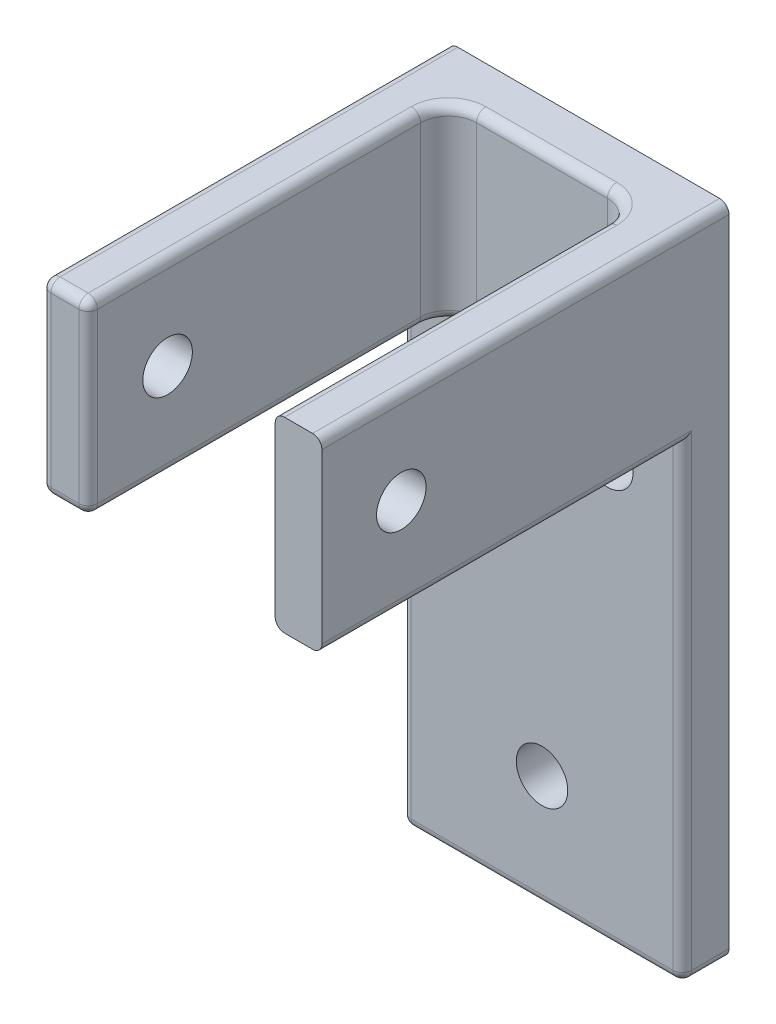
from build123d import *

# Parameters (mm, degrees)
SKETCH1_W            = 30
SKETCH1_H            = 70
BOSS_EXTRUDE1_DEPTH  = 5
M5_CLEARANCE_HOLE1_D = 5.5
SKETCH4_W            = 5
SKETCH4_H            = 20
BOSS_EXTRUDE2_DEPTH  = 38.541999878
M5_CLEARANCE_HOLE2_D = 5.3
FILLET1_R            = 3
FILLET2_R            = 1
FILLET3_R            = 1
FILLET4_R            = 1
FILLET5_R            = 1
FILLET6_R            = 1


with BuildPart() as part:
    # Sketch1 → Boss-Extrude1 (new body)
    with BuildSketch(Plane.XY):
        Rectangle(SKETCH1_W, SKETCH1_H)
    extrude(amount=BOSS_EXTRUDE1_DEPTH)

    # M5 Clearance Hole1 (through all)
    with Locations(Plane.XY.offset(5)):
        with Locations((0, -23), (-7, 10), (7, 10)):
            Hole(M5_CLEARANCE_HOLE1_D / 2)

    # Sketch4 → Boss-Extrude2 (add)
    with BuildSketch(Plane.XY.offset(5)):
        with Locations((-12.5, 25)):
            Rectangle(SKETCH4_W, SKETCH4_H)
        with Locations((12.5, 25)):
            Rectangle(SKETCH4_W, SKETCH4_H)
    extrude(amount=BOSS_EXTRUDE2_DEPTH)

    # M5 Clearance Hole2 (through all)
    with Locations(Plane.ZY.offset(15)):
        with Locations((35.052, 25)):
            Hole(M5_CLEARANCE_HOLE2_D / 2)

    # Fillet1
    fillet1_edges = [part.edges().sort_by_distance(p)[0] for p in [
        (-10, 25, 5),
        (10, 25, 5),
    ]]
    fillet(fillet1_edges, radius=FILLET1_R)

    # Fillet2
    fillet2_edges = [part.edges().sort_by_distance(p)[0] for p in [
        (-15, 25, 43.541999878),
        (-10, 25, 43.541999878),
    ]]
    fillet(fillet2_edges, radius=FILLET2_R)

    # Fillet3
    # the kernel refuses this fillet: 1 mm, written as the material it takes off along each edge
    with BuildSketch(Plane(origin=(7, 15, 8), x_dir=(-0.7404019062872322, 0, -0.6721644271800112), z_dir=(-0.6721644271800112, 0, 0.7404019062872322))) as fillet3_piece_1_section:
        with BuildLine():
            CenterArc((3 + FILLET3_R, -FILLET3_R), FILLET3_R, 90, 90)
            Line((3 + FILLET3_R, 0), (3, 0))
            Line((3, 0), (3, -FILLET3_R))
        make_face()
    fillet3_piece_1 = revolve(axis=Axis((7, 15, 8), (0, -1, 0)), revolution_arc=137.765663079, mode=Mode.PRIVATE)
    fillet3_piece_1 = split(fillet3_piece_1, bisect_by=Plane(origin=(9.145909212, 15.257974559, 5), z_dir=(0, 0, 1)), keep=Keep.TOP, mode=Mode.PRIVATE)
    add(fillet3_piece_1, mode=Mode.SUBTRACT)
    with BuildSketch(Plane(origin=(-7, 15, 8), x_dir=(0.7404019062872333, 0, -0.6721644271800099), z_dir=(0.6721644271800099, 0, 0.7404019062872333))) as fillet3_piece_2_section:
        with BuildLine():
            CenterArc((3 + FILLET3_R, FILLET3_R), FILLET3_R, 180, 90)
            Line((3 + FILLET3_R, 0), (3, 0))
            Line((3, 0), (3, FILLET3_R))
        make_face()
    fillet3_piece_2 = revolve(axis=Axis((-7, 15, 8), (0, 1, 0)), revolution_arc=137.765663079, mode=Mode.PRIVATE)
    fillet3_piece_2 = split(fillet3_piece_2, bisect_by=Plane(origin=(-9.145909903, 15.257974038, 5), z_dir=(0, 0, 1)), keep=Keep.TOP, mode=Mode.PRIVATE)
    add(fillet3_piece_2, mode=Mode.SUBTRACT)
    with BuildSketch(Plane(origin=(-10, 15, 8), x_dir=(0, 1, 0), z_dir=(0, 0, 1))) as fillet3_piece_3:
        with BuildLine():
            CenterArc((FILLET3_R, FILLET3_R), FILLET3_R, 180, 90)
            Line((0, FILLET3_R), (0, 0))
            Line((0, 0), (FILLET3_R, 0))
        make_face()
    extrude(amount=34.541999878, mode=Mode.SUBTRACT)
    with BuildSketch(Plane(origin=(-11, 15, 42.541999878), x_dir=(1, 0, 0), z_dir=(0, 0, -1))) as fillet3_piece_4:
        with BuildLine():
            CenterArc((1 - FILLET3_R, -FILLET3_R), FILLET3_R, 0, 90)
            Line((1 - FILLET3_R, 0), (1, 0))
            Line((1, 0), (1, -FILLET3_R))
        make_face()
    revolve(axis=Axis((-11, 15, 42.541999878), (0, -1, 0)), revolution_arc=90, mode=Mode.SUBTRACT)
    with BuildSketch(Plane(origin=(-11, 15, 43.541999878), x_dir=(0, 0, -1), z_dir=(-1, 0, 0)), Plane(origin=(-14, 35, 43.541999878), x_dir=(0, 0, -1), z_dir=(1, 0, 0))) as fillet3_piece_5:
        with BuildLine():
            CenterArc((FILLET3_R, -FILLET3_R), FILLET3_R, 90, 90)
            Line((0, -FILLET3_R), (0, 0))
            Line((0, 0), (FILLET3_R, 0))
        make_face()
    extrude(amount=3, mode=Mode.SUBTRACT)
    with BuildSketch(Plane(origin=(-14, 15, 42.541999878), x_dir=(0, 0, 1), z_dir=(1, 0, 0))) as fillet3_piece_6:
        with BuildLine():
            CenterArc((1 - FILLET3_R, -FILLET3_R), FILLET3_R, 0, 90)
            Line((1, -FILLET3_R), (1, 0))
            Line((1, 0), (1 - FILLET3_R, 0))
        make_face()
    revolve(axis=Axis((-14, 15, 42.541999878), (0, -1, 0)), revolution_arc=90, mode=Mode.SUBTRACT)
    with BuildSketch(Plane(origin=(7, 35, 8), x_dir=(0, 0, -1), z_dir=(-1, 0, 0))) as fillet3_piece_7:
        with BuildLine():
            CenterArc((3 + FILLET3_R, FILLET3_R), FILLET3_R, 180, 90)
            Line((3, FILLET3_R), (3, 0))
            Line((3, 0), (3 + FILLET3_R, 0))
        make_face()
    revolve(axis=Axis((7, 35, 8), (0, -1, 0)), revolution_arc=90, mode=Mode.SUBTRACT)
    with BuildSketch(Plane(origin=(-7, 35, 5), x_dir=(0, 0, -1), z_dir=(1, 0, 0))) as fillet3_piece_8:
        with BuildLine():
            CenterArc((FILLET3_R, -FILLET3_R), FILLET3_R, 90, 90)
            Line((0, -FILLET3_R), (0, 0))
            Line((0, 0), (FILLET3_R, 0))
        make_face()
    extrude(amount=14, mode=Mode.SUBTRACT)
    with BuildSketch(Plane(origin=(-7, 35, 8), x_dir=(0, 0, -1), z_dir=(1, 0, 0))) as fillet3_piece_9:
        with BuildLine():
            CenterArc((3 + FILLET3_R, -FILLET3_R), FILLET3_R, 90, 90)
            Line((3, -FILLET3_R), (3, 0))
            Line((3, 0), (3 + FILLET3_R, 0))
        make_face()
    revolve(axis=Axis((-7, 35, 8), (0, 1, 0)), revolution_arc=90, mode=Mode.SUBTRACT)
    with BuildSketch(Plane(origin=(-10, 35, 8), x_dir=(0, -1, 0), z_dir=(0, 0, 1))) as fillet3_piece_10:
        with BuildLine():
            CenterArc((FILLET3_R, -FILLET3_R), FILLET3_R, 90, 90)
            Line((0, -FILLET3_R), (0, 0))
            Line((0, 0), (FILLET3_R, 0))
        make_face()
    extrude(amount=34.541999878, mode=Mode.SUBTRACT)
    with BuildSketch(Plane(origin=(-11, 35, 42.541999878), x_dir=(1, 0, 0), z_dir=(0, 0, -1))) as fillet3_piece_11:
        with BuildLine():
            CenterArc((1 - FILLET3_R, FILLET3_R), FILLET3_R, 270, 90)
            Line((1, FILLET3_R), (1, 0))
            Line((1, 0), (1 - FILLET3_R, 0))
        make_face()
    revolve(axis=Axis((-11, 35, 42.541999878), (0, -1, 0)), revolution_arc=90, mode=Mode.SUBTRACT)
    with BuildSketch(Plane(origin=(-14, 35, 42.541999878), x_dir=(0, 0, 1), z_dir=(1, 0, 0))) as fillet3_piece_12:
        with BuildLine():
            CenterArc((1 - FILLET3_R, FILLET3_R), FILLET3_R, 270, 90)
            Line((1, FILLET3_R), (1, 0))
            Line((1, 0), (1 - FILLET3_R, 0))
        make_face()
    revolve(axis=Axis((-14, 35, 42.541999878), (0, -1, 0)), revolution_arc=90, mode=Mode.SUBTRACT)
    with BuildSketch(Plane(origin=(10, 35, 8), x_dir=(1, 0, 0), z_dir=(0, 0, 1)), Plane(origin=(10, 15, 8), x_dir=(0, 1, 0), z_dir=(0, 0, 1))) as fillet3_piece_13:
        with BuildLine():
            CenterArc((FILLET3_R, -FILLET3_R), FILLET3_R, 90, 90)
            Line((0, -FILLET3_R), (0, 0))
            Line((0, 0), (FILLET3_R, 0))
        make_face()
    extrude(amount=38.041999878, mode=Mode.SUBTRACT)
    with BuildSketch(Plane(origin=(-15, 15, 5), x_dir=(1, 0, 0), z_dir=(0, 0, 1))) as fillet3_piece_14:
        with BuildLine():
            CenterArc((FILLET3_R, FILLET3_R), FILLET3_R, 180, 90)
            Line((0, FILLET3_R), (0, 0))
            Line((0, 0), (FILLET3_R, 0))
        make_face()
    extrude(amount=37.541999878, mode=Mode.SUBTRACT)
    with BuildSketch(Plane(origin=(-15, 35, 42.541999878), x_dir=(1, 0, 0), z_dir=(0, 0, -1))) as fillet3_piece_15:
        with BuildLine():
            CenterArc((FILLET3_R, FILLET3_R), FILLET3_R, 180, 90)
            Line((0, FILLET3_R), (0, 0))
            Line((0, 0), (FILLET3_R, 0))
        make_face()
    extrude(amount=45.041999878, mode=Mode.SUBTRACT)

    # Fillet4
    fillet4_edges = [part.edges().sort_by_distance(p)[0] for p in [
        (15, 15, 24.270999939),
        (15, 35, 21.770999939),
    ]]
    fillet(fillet4_edges, radius=FILLET4_R)

    # Fillet5
    fillet5_edges = [part.edges().sort_by_distance(p)[0] for p in [
        (-15, -9.5, 5),
        (15, -9.5, 5),
    ]]
    fillet(fillet5_edges, radius=FILLET5_R)

    # Fillet6
    fillet6_edges = [part.edges().sort_by_distance(p)[0] for p in [
        (0, -35, 5),
        (15, -35, 2),
        (-15, -35, 2),
        (14.707106781, -35, 4.707106781),
        (-14.707106781, -35, 4.707106781),
    ]]
    fillet(fillet6_edges, radius=FILLET6_R)


solid = part.part
